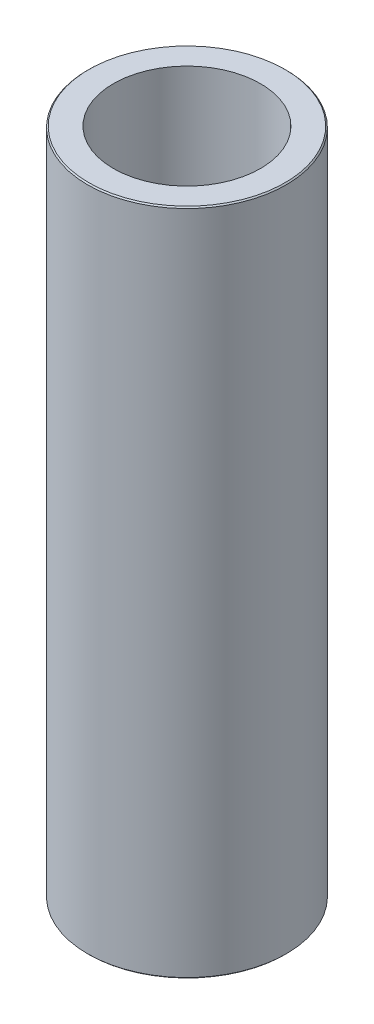
from build123d import *

# Parameters (mm, degrees)
SKETCH1_R           = 25
BOSS_EXTRUDE1_DEPTH = 168.235638256
SKETCH2_R           = 18.513562957
CUT_EXTRUDE1_DEPTH  = 172.910528996
CHAMFER1_SIZE       = 0.30478354


with BuildPart() as part:
    # Sketch1 → Boss-Extrude1 (new body)
    with BuildSketch(Plane(origin=(0, 0, 0), x_dir=(1, 0, 0), z_dir=(0, 1, 0))):
        Circle(SKETCH1_R)
    extrude(amount=BOSS_EXTRUDE1_DEPTH)

    # Sketch2 → Cut-Extrude1 (cut, through all)
    with BuildSketch(Plane(origin=(0, 0, 0), x_dir=(1, 0, 0), z_dir=(0, 1, 0))):
        Circle(SKETCH2_R)
    extrude(amount=CUT_EXTRUDE1_DEPTH, mode=Mode.SUBTRACT)

    # Chamfer1
    chamfer1_edges = [part.edges().sort_by_distance(p)[0] for p in [
        (-25, 168.235638256, 0),
        (-25, 0, 0),
    ]]
    chamfer(chamfer1_edges, length=CHAMFER1_SIZE)


solid = part.part
